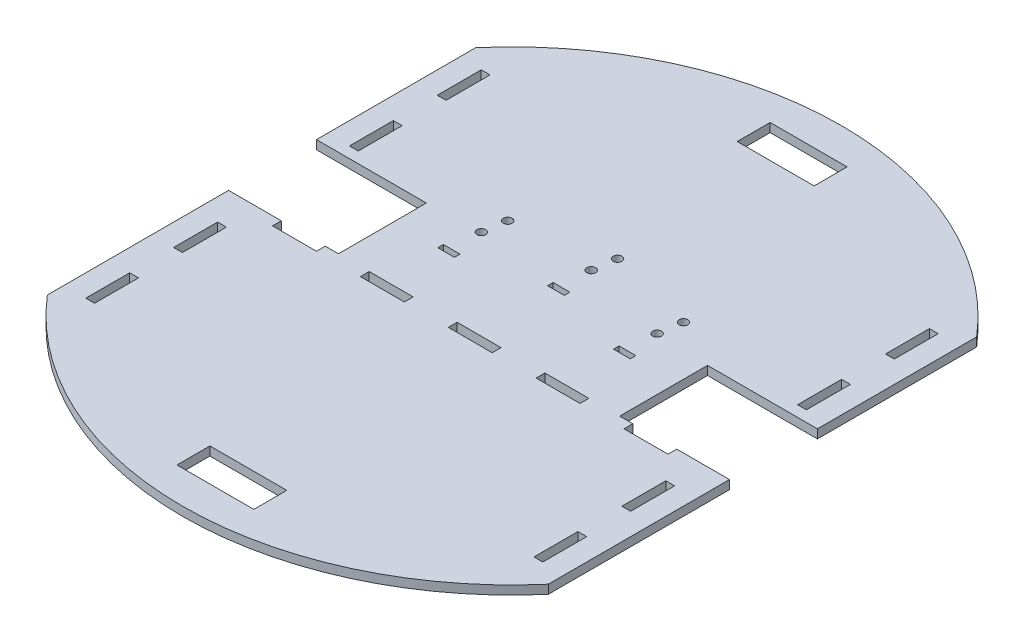
from build123d import *

# Parameters (mm, degrees)
SKICA1_W                = 35
SKICA1_H                = 15
SKICA1_R                = 2
SKICA1_W_2              = 7.62
SKICA1_H_2              = 2.54
SKICA1_W_3              = 4
SKICA1_H_3              = 20
SKICA1_W_4              = 20
SKICA1_H_4              = 4
P_IDAT_VYSUNUT_M1_DEPTH = 4


with BuildPart() as part:
    # Skica1 → Přidat vysunutím1 (new body)
    with BuildSketch(Plane(origin=(0, 0, 0), x_dir=(1, 0, 0), z_dir=(0, 1, 0))):
        with BuildLine():
            Line((-114, 97.488460856), (-114, 25))
            Line((-114, 25), (-64, 25))
            Line((-64, 25), (-64, -15))
            Line((-64, -15), (-70, -15))
            Line((-70, -15), (-70, -19))
            Line((-70, -19), (-90, -19))
            Line((-90, -19), (-90, -15))
            Line((-90, -15), (-114, -15))
            Line((-114, -15), (-114, -97.488460856))
            ThreePointArc((-114, -97.488460856), (0, -150), (114, -97.488460856))
            Line((114, -97.488460856), (114, -15))
            Line((114, -15), (90, -15))
            Line((90, -15), (90, -19))
            Line((90, -19), (70, -19))
            Line((70, -19), (70, -15))
            Line((70, -15), (64, -15))
            Line((64, -15), (64, 25))
            Line((64, 25), (114, 25))
            Line((114, 25), (114, 97.488460856))
            ThreePointArc((114, 97.488460856), (0, 150), (-114, 97.488460856))
        make_face()
        with Locations((0, 127.5)):
            Rectangle(SKICA1_W, SKICA1_H, mode=Mode.SUBTRACT)
        with Locations((1.5, 46.54)):
            Circle(SKICA1_R, mode=Mode.SUBTRACT)
        with Locations((0, 36.04)):
            Circle(SKICA1_R, mode=Mode.SUBTRACT)
        with Locations((0, 21.27)):
            Rectangle(SKICA1_W_2, SKICA1_H_2, mode=Mode.SUBTRACT)
        with Locations((-102, 40)):
            Rectangle(SKICA1_W_3, SKICA1_H_3, mode=Mode.SUBTRACT)
        Polygon((-36.19, 10), (-43.81, 10), (-43.81, 12.54), (-40, 12.54), (-36.19, 12.54), align=None, mode=Mode.SUBTRACT)
        with Locations((-40, 26.04)):
            Circle(SKICA1_R, mode=Mode.SUBTRACT)
        with Locations((-38.5, 36.54)):
            Circle(SKICA1_R, mode=Mode.SUBTRACT)
        with Locations((-102, 80)):
            Rectangle(SKICA1_W_3, SKICA1_H_3, mode=Mode.SUBTRACT)
        with Locations((102, 80)):
            Rectangle(SKICA1_W_3, SKICA1_H_3, mode=Mode.SUBTRACT)
        Polygon((43.81, 12.54), (43.81, 10), (36.19, 10), (36.19, 12.54), (40, 12.54), align=None, mode=Mode.SUBTRACT)
        with Locations((40, 26.04)):
            Circle(SKICA1_R, mode=Mode.SUBTRACT)
        with Locations((41.5, 36.54)):
            Circle(SKICA1_R, mode=Mode.SUBTRACT)
        with Locations((102, 40)):
            Rectangle(SKICA1_W_3, SKICA1_H_3, mode=Mode.SUBTRACT)
        with Locations((-40, -17)):
            Rectangle(SKICA1_W_4, SKICA1_H_4, mode=Mode.SUBTRACT)
        with Locations((0, -17)):
            Rectangle(SKICA1_W_4, SKICA1_H_4, mode=Mode.SUBTRACT)
        with Locations((0, -127.5)):
            Rectangle(SKICA1_W, SKICA1_H, mode=Mode.SUBTRACT)
        with Locations((-102, -80)):
            Rectangle(SKICA1_W_3, SKICA1_H_3, mode=Mode.SUBTRACT)
        with Locations((-102, -40)):
            Rectangle(SKICA1_W_3, SKICA1_H_3, mode=Mode.SUBTRACT)
        with Locations((102, -40)):
            Rectangle(SKICA1_W_3, SKICA1_H_3, mode=Mode.SUBTRACT)
        with Locations((102, -80)):
            Rectangle(SKICA1_W_3, SKICA1_H_3, mode=Mode.SUBTRACT)
        with Locations((40, -17)):
            Rectangle(SKICA1_W_4, SKICA1_H_4, mode=Mode.SUBTRACT)
    extrude(amount=P_IDAT_VYSUNUT_M1_DEPTH)


solid = part.part
